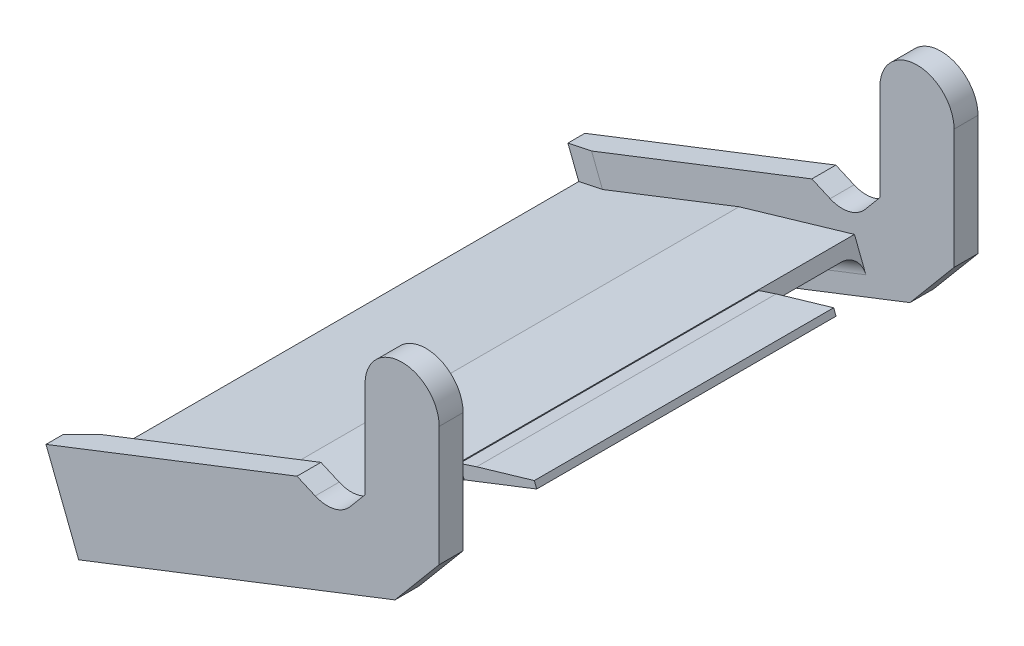
from build123d import *
from OCP.BRepFilletAPI import BRepFilletAPI_MakeChamfer

# Parameters (mm, degrees)
ESTRUSIONE_ESTRUSIONE1_DEPTH = 4
ESTRUSIONE_ESTRUSIONE2_DEPTH = 82
ESTRUSIONE_ESTRUSIONE3_START = 4
ESTRUSIONE_ESTRUSIONE3_DEPTH = 4
SCHIZZO6_W                   = 50
SCHIZZO6_H                   = 4
ESTRUSIONE_ESTRUSIONE4_DEPTH = 5
SMUSSO1_SIZE                 = 5.5
SMUSSO1_SIZE2                = 1.169061089
RACCORDO1_R                  = 3
SMUSSO2_SIZE                 = 5
RACCORDO2_START              = -86
RACCORDO2_DEPTH              = 4
RACCORDO2_2_DEPTH            = 4
SCHIZZO7_W                   = 50
SCHIZZO7_H                   = 2.5
ESTRUSIONE_ESTRUSIONE5_DEPTH = 13
SMUSSO3_SIZE                 = 20
SMUSSO3_SIZE_2               = 1.048155586
SMUSSO4_SIZE                 = 20
SMUSSO4_SIZE2                = 1.749773271
SMUSSO5_SIZE                 = 10
SMUSSO5_SIZE2                = 0.350328071


with BuildPart() as part:
    # Schizzo1 → Estrusione-Estrusione1 (new body)
    with BuildSketch(Plane.XY):
        with BuildLine():
            Line((4.891723927, 5.829729564), (4.891723927, 21.912236928))
            ThreePointArc((4.891723927, 21.912236928), (11.08058435, 28.101097351), (17.269444773, 21.912236928))
            Line((17.269444773, 21.912236928), (17.269444773, 1.912236928))
            Line((17.269444773, 1.912236928), (9.899185428, -6.871296125))
            Line((9.899185428, -6.871296125), (-42.94312967, -27.493410377))
            Line((-42.94312967, -27.493410377), (-46.57866514, -18.177677349))
            Line((-46.57866514, -18.177677349), (0, 0))
            Line((0, 0), (4.891723927, 5.829729564))
        make_face()
    extrude(amount=ESTRUSIONE_ESTRUSIONE1_DEPTH)

    # Schizzo4 → Estrusione-Estrusione2 (add)
    with BuildSketch(Plane.XY):
        Polygon((-45.124450952, -21.90397056), (1.454214188, -3.726293211), (0, 0), (-46.57866514, -18.177677349), align=None)
    extrude(amount=-ESTRUSIONE_ESTRUSIONE2_DEPTH)

    # Schizzo5 → Estrusione-Estrusione3 (add)
    with BuildSketch(Plane(origin=(0, 0, -82), x_dir=(-1, 0, 0), z_dir=(0, 0, -1)).offset(ESTRUSIONE_ESTRUSIONE3_START)):
        with BuildLine():
            Line((42.94312967, -27.493410377), (46.57866514, -18.177677349))
            Line((46.57866514, -18.177677349), (0, 0))
            Line((0, 0), (-4.891723927, 5.829729564))
            Line((-4.891723927, 5.829729564), (-4.891723927, 21.912236928))
            ThreePointArc((-4.891723927, 21.912236928), (-11.08058435, 28.101097351), (-17.269444773, 21.912236928))
            Line((-17.269444773, 21.912236928), (-17.269444773, 1.912236928))
            Line((-17.269444773, 1.912236928), (-9.899185428, -6.871296125))
            Line((-9.899185428, -6.871296125), (42.94312967, -27.493410377))
        make_face()
    extrude(amount=-ESTRUSIONE_ESTRUSIONE3_DEPTH)

    # Schizzo6 → Estrusione-Estrusione4 (add)
    with BuildSketch(Plane(origin=(0, 0, 0), x_dir=(0.9315733027957475, 0.36355354697516373, 0), z_dir=(-0.36355354697516373, 0.9315733027957475, 0))):
        with Locations((-25, 84)):
            Rectangle(SCHIZZO6_W, SCHIZZO6_H)
        with Locations((-25, -2)):
            Rectangle(SCHIZZO6_W, SCHIZZO6_H)
    extrude(amount=ESTRUSIONE_ESTRUSIONE4_DEPTH)

    # Smusso1: one chamfer whose edges measure the first distance from different faces: ONE call of the kernel's chamfer builder (chamfer() names one face for all edges)
    smusso1_edges_1 = [part.edges().sort_by_distance(p)[0] for p in [
        (-47.487549007, -15.848744092, -82),
    ]]
    smusso1_side_1 = [part.faces().sort_by_distance(p)[0] for p in [
        (-24.198216437, -6.759905417, -82),
    ]]
    smusso1_edges_2 = [part.edges().sort_by_distance(p)[0] for p in [
        (-47.487549007, -15.848744092, 0),
    ]]
    smusso1_side_2 = [part.faces().sort_by_distance(p)[0] for p in [
        (-24.198216437, -6.759905417, 0),
    ]]
    smusso1 = BRepFilletAPI_MakeChamfer(part.part.solid().wrapped)
    for e in smusso1_edges_1:
        smusso1.Add(SMUSSO1_SIZE, SMUSSO1_SIZE2, e.wrapped, smusso1_side_1[0].wrapped)  # the first distance lies on this face
    for e in smusso1_edges_2:
        smusso1.Add(SMUSSO1_SIZE, SMUSSO1_SIZE2, e.wrapped, smusso1_side_2[0].wrapped)  # the first distance lies on this face
    add(Compound.cast(smusso1.Shape()), mode=Mode.REPLACE)

    # Raccordo1
    raccordo1_edges = [part.edges().sort_by_distance(p)[0] for p in [
        (-21.835118382, -12.815131886, -82),
        (-21.835118382, -12.815131886, 0),
    ]]
    fillet(raccordo1_edges, radius=RACCORDO1_R)

    # Smusso2
    smusso2_edges = [part.edges().sort_by_distance(p)[0] for p in [
        (-1.817767735, 4.657866514, 2),
        (-1.817767735, 4.657866514, -84),
    ]]
    chamfer(smusso2_edges, length=SMUSSO2_SIZE - 0.0001)  # a hair under: the kernel refuses the full size

    # Raccordo2: read off the stored shape, not the designer's step
    # Raccordo2 outline → Raccordo2 (add)
    with BuildSketch(Plane.XY.offset(RACCORDO2_START)):
        with BuildLine():
            Line((0, 0), (2.407895765, 2.869618428))
            ThreePointArc((2.407895765, 2.869618428), (-0.284030607, 1.214852073), (-3.430579557, 1.504591587))
            Line((-3.430579557, 1.504591587), (0, 0))
        make_face()
    extrude(amount=RACCORDO2_DEPTH)

    # Raccordo2 2 outline → Raccordo2 2 (add)
    with BuildSketch(Plane.XY):
        with BuildLine():
            Line((0, 0), (2.407895765, 2.869618428))
            ThreePointArc((2.407895765, 2.869618428), (-0.284030607, 1.214852073), (-3.430579557, 1.504591587))
            Line((-3.430579557, 1.504591587), (0, 0))
        make_face()
    extrude(amount=RACCORDO2_2_DEPTH)

    # Schizzo7 → Estrusione-Estrusione5 (add)
    with BuildSketch(Plane(origin=(0, 0, 0), x_dir=(0, 0, -1), z_dir=(0.9315733027957472, 0.3635535469751644, 0))):
        with Locations((41, -2.75)):
            Rectangle(SCHIZZO7_W, SCHIZZO7_H)
    extrude(amount=ESTRUSIONE_ESTRUSIONE5_DEPTH)

    # Smusso3
    # the kernel refuses this chamfer: 20, 1.048155586 mm, written as the material it takes off along each edge
    with BuildSketch(Plane(origin=(12.655783257, 3.328836156, -16), x_dir=(-0.9315733027957472, -0.3635535469751644, 0), z_dir=(0, 0, -1))) as smusso3_piece_1_section:
        Polygon((SMUSSO3_SIZE, 0), (0, -SMUSSO3_SIZE_2), (0, 0), align=None)
    smusso3_piece_1 = extrude(amount=50, mode=Mode.PRIVATE)
    smusso3_piece_1 = split(smusso3_piece_1, bisect_by=Plane(origin=(0.54533032, -1.397359954, -16), z_dir=(0.9315733027957472, 0.36355354697516445, 0)), keep=Keep.TOP, mode=Mode.PRIVATE)
    add(smusso3_piece_1, mode=Mode.SUBTRACT)

    # Smusso4
    smusso4_edges = [part.edges().sort_by_distance(p)[0] for p in [
        (0, 0, -41),
    ]]
    smusso4_side = [part.faces().sort_by_distance(p)[0] for p in [
        (-23.323124739, -9.102026325, -41),
    ]]
    chamfer(smusso4_edges, length=SMUSSO4_SIZE, length2=SMUSSO4_SIZE2, reference=smusso4_side[0])

    # Smusso5
    smusso5_edges = [part.edges().sort_by_distance(p)[0] for p in [
        (13.036843938, 2.352402395, -41),
    ]]
    smusso5_side = [part.faces().sort_by_distance(p)[0] for p in [
        (6.857772748, 0.306645312, -41),
    ]]
    chamfer(smusso5_edges, length=SMUSSO5_SIZE, length2=SMUSSO5_SIZE2, reference=smusso5_side[0])


solid = part.part
